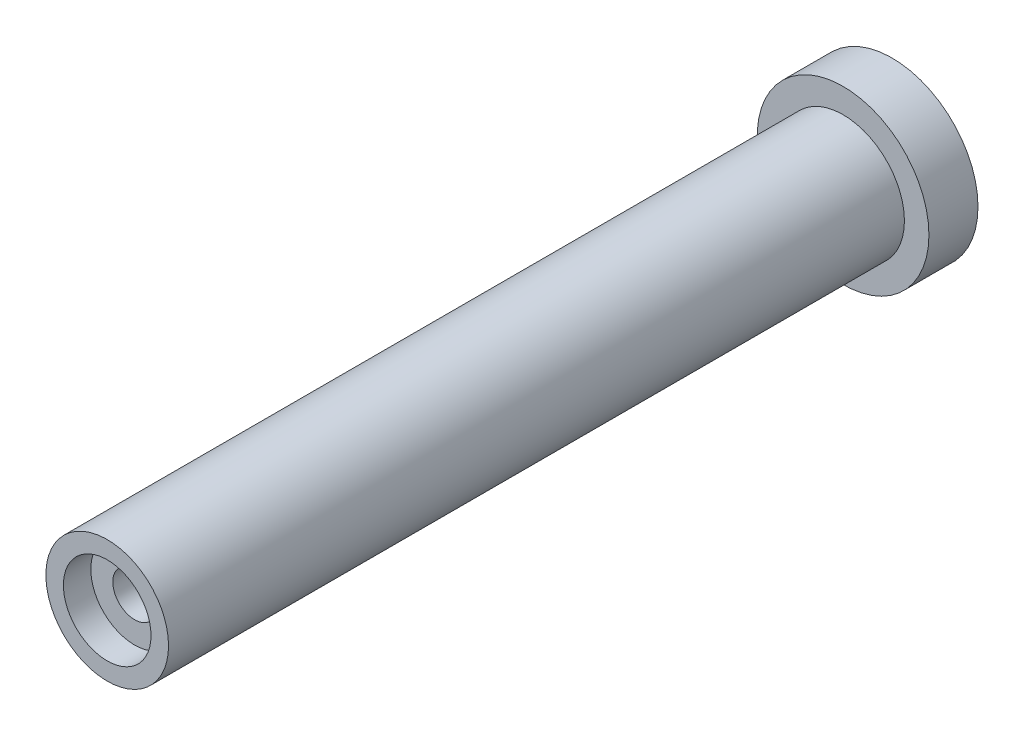
from build123d import *

# Parameters (mm, degrees)
ESQUISSE1_R                                      = 2.5
BOSS_EXTRU_1_DEPTH                               = 30
ESQUISSE2_R                                      = 3.5
BOSS_EXTRU_2_DEPTH                               = 2
CHAMBRAGE_POUR_VIS_T_TE_RONDE_BOMB_E_D           = 1.778
CHAMBRAGE_POUR_VIS_T_TE_RONDE_BOMB_E_DEPTH       = 6
CHAMBRAGE_POUR_VIS_T_TE_RONDE_BOMB_E_CBORE_D     = 3.57124
CHAMBRAGE_POUR_VIS_T_TE_RONDE_BOMB_E_CBORE_DEPTH = 1.1176
CHAMBRAGE_POUR_VIS_T_TE_RONDE_BOMB_E_TIP         = 0.53416509


with BuildPart() as part:
    # Esquisse1 → Boss.-Extru.1 (new body)
    with BuildSketch(Plane.XY):
        Circle(ESQUISSE1_R)
    extrude(amount=BOSS_EXTRU_1_DEPTH)

    # Esquisse2 → Boss.-Extru.2 (add)
    with BuildSketch(Plane.XY):
        Circle(ESQUISSE2_R)
        Polygon((-1.718731116, -0.115769453), (-1.718731116, 0.115769453), (-0.115769453, 0.115769453), (-0.115769453, 1.718731116), (0.115769453, 1.718731116), (0.115769453, 0.115769453), (1.718731116, 0.115769453), (1.718731116, -0.115769453), (0.115769453, -0.115769453), (0.115769453, -1.718731116), (-0.115769453, -1.718731116), (-0.115769453, -0.115769453), align=None, mode=Mode.SUBTRACT)
    extrude(amount=-BOSS_EXTRU_2_DEPTH)

    # Chambrage pour vis à tête ronde bombée #01
    with Locations(Plane.XY.offset(30)):
        with Locations((0, 0)):
            CounterBoreHole(CHAMBRAGE_POUR_VIS_T_TE_RONDE_BOMB_E_D / 2, CHAMBRAGE_POUR_VIS_T_TE_RONDE_BOMB_E_CBORE_D / 2, CHAMBRAGE_POUR_VIS_T_TE_RONDE_BOMB_E_CBORE_DEPTH, depth=CHAMBRAGE_POUR_VIS_T_TE_RONDE_BOMB_E_DEPTH)
            with Locations((0, 0, -(CHAMBRAGE_POUR_VIS_T_TE_RONDE_BOMB_E_DEPTH + CHAMBRAGE_POUR_VIS_T_TE_RONDE_BOMB_E_TIP / 2))):  # 118° drill point
                Cone(0, CHAMBRAGE_POUR_VIS_T_TE_RONDE_BOMB_E_D / 2, CHAMBRAGE_POUR_VIS_T_TE_RONDE_BOMB_E_TIP, mode=Mode.SUBTRACT)


solid = part.part
